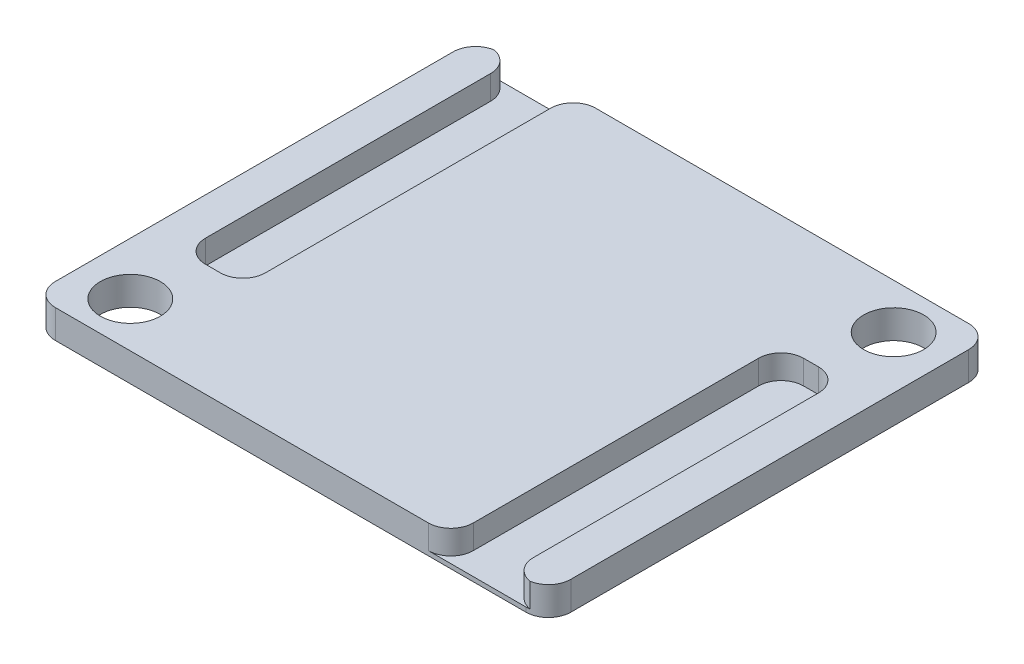
from build123d import *

# Parameters (mm, degrees)
CROQUIS1_W              = 34.35
CROQUIS1_H              = 29.5
CROQUIS1_R              = 2
SALIENTE_EXTRUIR1_DEPTH = 1.9
CROQUIS2_W              = 4
CROQUIS2_H              = 22
CORTAR_EXTRUIR2_DEPTH   = 1.6
REDONDEO1_R             = 1.5


with BuildPart() as part:
    # Croquis1 → Saliente-Extruir1 (new body)
    with BuildSketch(Plane(origin=(0, 0, 0), x_dir=(1, 0, 0), z_dir=(0, 1, 0))):
        with Locations((17.175, 14.75)):
            Rectangle(CROQUIS1_W, CROQUIS1_H)
        with Locations(Location((3.5, 3, 0), (0, 0, 90))):
            Circle(CROQUIS1_R, mode=Mode.SUBTRACT)
        with Locations(Location((30.85, 26.5, 0), (0, 0, 90))):
            Circle(CROQUIS1_R, mode=Mode.SUBTRACT)
    extrude(amount=SALIENTE_EXTRUIR1_DEPTH)

    # Croquis2 → Cortar-Extruir2 (cut)
    with BuildSketch(Plane(origin=(0, 1.9, 0), x_dir=(1, 0, 0), z_dir=(0, 1, 0))):
        with Locations((29.85, 11)):
            Rectangle(CROQUIS2_W, CROQUIS2_H)
        with Locations((4.5, 18.5)):
            Rectangle(CROQUIS2_W, CROQUIS2_H)
    extrude(amount=-CORTAR_EXTRUIR2_DEPTH, mode=Mode.SUBTRACT)

    # Redondeo1
    # the kernel refuses this fillet: 1.5 mm, written as the material it adds along each edge
    with BuildSketch(Plane(origin=(27.85, 1.9, -22), x_dir=(0, 0, 1), z_dir=(0, -1, 0))) as redondeo1_piece_1:
        with BuildLine():
            CenterArc((REDONDEO1_R, -REDONDEO1_R), REDONDEO1_R, 90, 90)
            Line((0, -REDONDEO1_R), (0, 0))
            Line((0, 0), (REDONDEO1_R, 0))
        make_face()
    extrude(amount=1.6)
    with BuildSketch(Plane(origin=(31.85, 1.9, -22), x_dir=(0, 0, 1), z_dir=(0, -1, 0)), Plane(origin=(2.5, 1.9, -7.5), x_dir=(0, 0, -1), z_dir=(0, -1, 0)), Plane(origin=(6.5, 1.9, -7.5), x_dir=(-1, 0, 0), z_dir=(0, -1, 0))) as redondeo1_piece_2:
        with BuildLine():
            CenterArc((REDONDEO1_R, REDONDEO1_R), REDONDEO1_R, 180, 90)
            Line((0, REDONDEO1_R), (0, 0))
            Line((0, 0), (REDONDEO1_R, 0))
        make_face()
    extrude(amount=1.6)
    # the kernel refuses this fillet: 1.5 mm, written as the material it takes off along each edge
    with BuildSketch(Plane(origin=(27.85, 5.65, 0), x_dir=(-1, 0, 0), z_dir=(0, -1, 0)), Plane(origin=(6.5, 5.65, -29.5), x_dir=(1, 0, 0), z_dir=(0, -1, 0))) as redondeo1_2_piece_1:
        with BuildLine():
            CenterArc((REDONDEO1_R, REDONDEO1_R), REDONDEO1_R, 180, 90)
            Line((0, REDONDEO1_R), (0, 0))
            Line((0, 0), (REDONDEO1_R, 0))
        make_face()
    extrude(amount=5.35, mode=Mode.SUBTRACT)
    with BuildSketch(Plane(origin=(31.85, 5.65, 0), x_dir=(1, 0, 0), z_dir=(0, -1, 0)), Plane(origin=(2.5, 5.65, -29.5), x_dir=(-1, 0, 0), z_dir=(0, -1, 0))) as redondeo1_2_piece_2:
        with BuildLine():
            CenterArc((REDONDEO1_R, -REDONDEO1_R), REDONDEO1_R, 90, 90)
            Line((0, -REDONDEO1_R), (0, 0))
            Line((0, 0), (REDONDEO1_R, 0))
        make_face()
    extrude(amount=5.35, mode=Mode.SUBTRACT)
    with BuildSketch(Plane(origin=(0, -3.75, -29.5), x_dir=(0, 0, 1), z_dir=(0, 1, 0)), Plane(origin=(0, -3.75, 0), x_dir=(1, 0, 0), z_dir=(0, 1, 0))) as redondeo1_2_piece_3:
        with BuildLine():
            CenterArc((REDONDEO1_R, REDONDEO1_R), REDONDEO1_R, 180, 90)
            Line((0, REDONDEO1_R), (0, 0))
            Line((0, 0), (REDONDEO1_R, 0))
        make_face()
    extrude(amount=9.4, mode=Mode.SUBTRACT)
    with BuildSketch(Plane(origin=(34.35, -3.75, -29.5), x_dir=(0, 0, 1), z_dir=(0, 1, 0)), Plane(origin=(34.35, -3.75, 0), x_dir=(-1, 0, 0), z_dir=(0, 1, 0))) as redondeo1_2_piece_4:
        with BuildLine():
            CenterArc((REDONDEO1_R, -REDONDEO1_R), REDONDEO1_R, 90, 90)
            Line((0, -REDONDEO1_R), (0, 0))
            Line((0, 0), (REDONDEO1_R, 0))
        make_face()
    extrude(amount=9.4, mode=Mode.SUBTRACT)


solid = part.part
